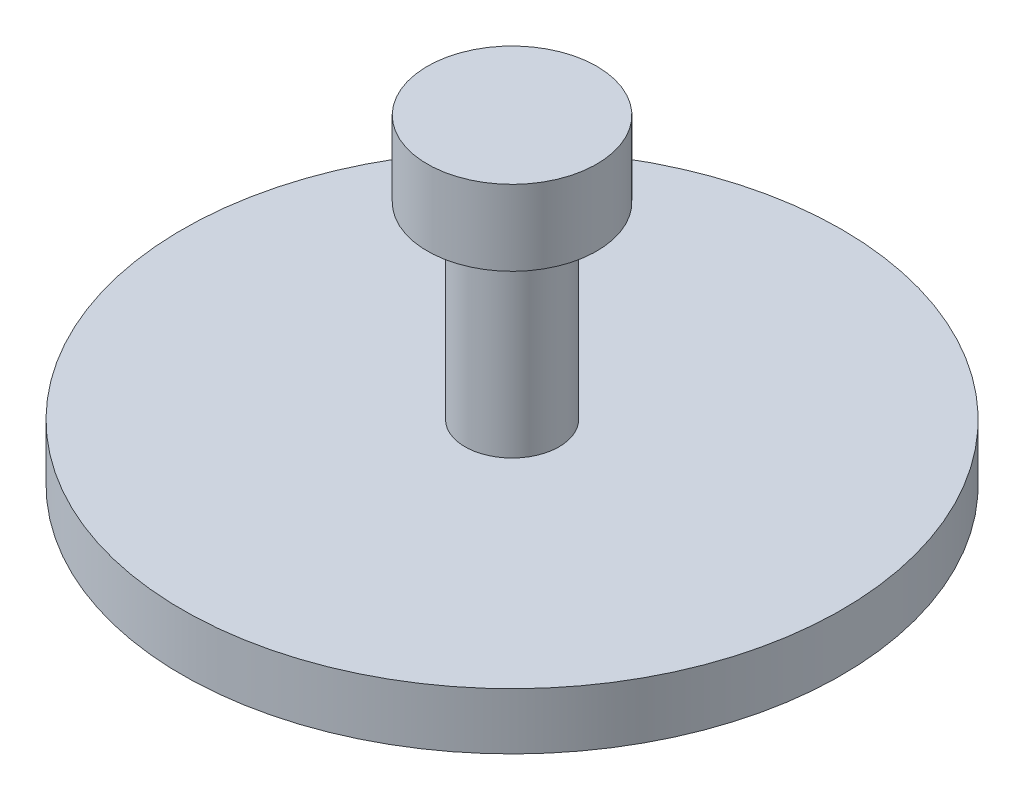
from build123d import *


with BuildPart() as part:
    # Sketch1 → Revolve1 (revolve)
    with BuildSketch(Plane.XY):
        Polygon((0, 0), (17.5, 0), (17.5, 3), (2.5, 3), (2.5, 13), (4.5, 13), (4.5, 17), (0, 17), align=None)
    revolve(axis=Axis((0, 0, 0), (0, 1, 0)))


solid = part.part
